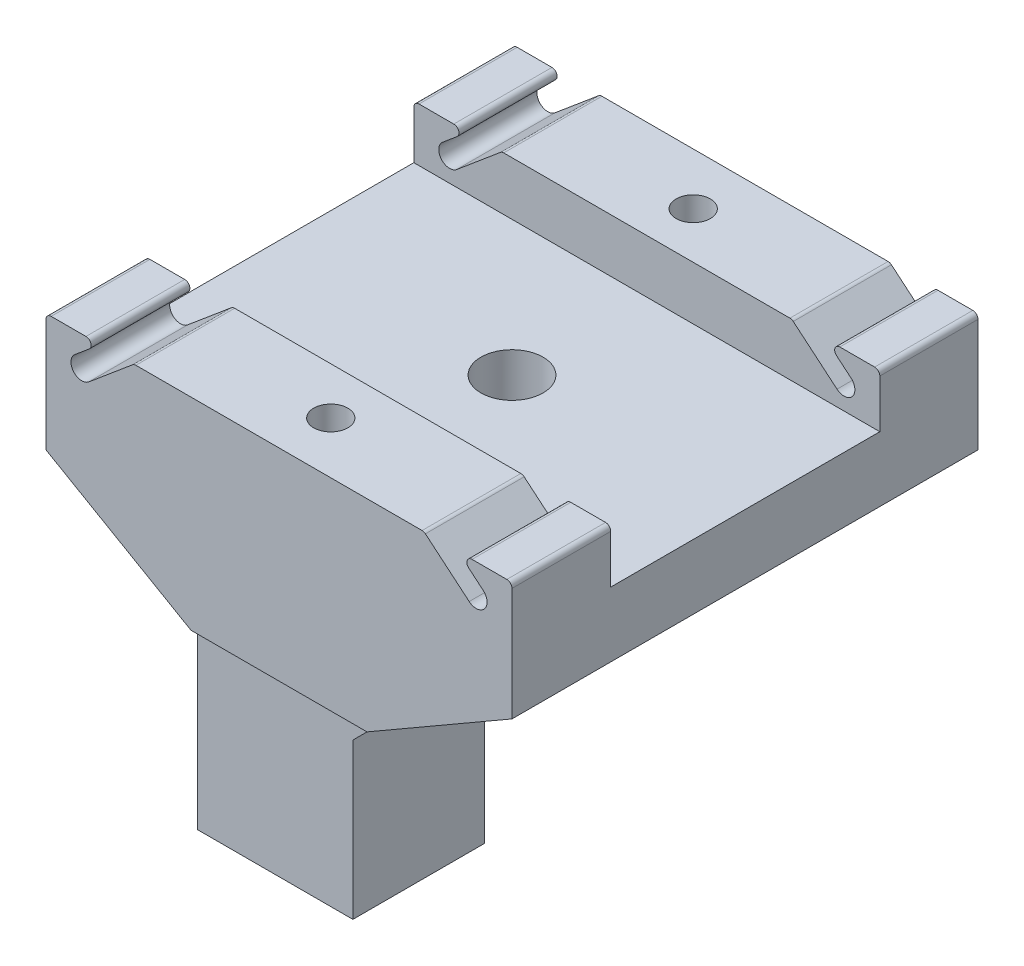
from build123d import *
from OCP.BRepFilletAPI import BRepFilletAPI_MakeChamfer

# Parameters (mm, degrees)
SKETCH1_W                 = 45
SKETCH1_H                 = 19.5
BOSS_EXTRUDE1_DEPTH       = 22.5
M4X0_7_TAPPED_HOLE2_D     = 3.3
BOSS_EXTRUDE3_DEPTH       = 6.3625
M4X0_7_TAPPED_HOLE1_D     = 3.3
M4X0_7_TAPPED_HOLE1_DEPTH = 10
M4X0_7_TAPPED_HOLE1_TIP   = 0.991420021
CUT_EXTRUDE2_DEPTH        = 85
SKETCH2_R                 = 3
CUT_EXTRUDE1_DEPTH        = 50
CUT_EXTRUDE3_DEPTH        = 25
FILLET1_R                 = 1.05
FILLET2_R                 = 1.05
FILLET3_R                 = 0.5
SKETCH12_W                = 25.984765903
SKETCH12_H                = 10.03603234
CUT_EXTRUDE4_DEPTH        = 72.15
CHAMFER1_SIZE             = 14
CHAMFER1_SIZE_2           = 8.082903769


with BuildPart() as part:
    # Sketch1 → Boss-Extrude1 (new, symmetric)
    with BuildSketch(Plane.XY):
        with Locations((0, -0.25)):
            Rectangle(SKETCH1_W, SKETCH1_H)
    extrude(amount=BOSS_EXTRUDE1_DEPTH, both=True)

    # M4x0.7 Tapped Hole2 (through all)
    with Locations(Plane(origin=(0, -10, 0), x_dir=(-1, 0, 0), z_dir=(0, -1, 0))):
        with Locations((0, -17.5), (0, 17.5)):
            Hole(M4X0_7_TAPPED_HOLE2_D / 2)

    # Sketch7 → Boss-Extrude3 (add, symmetric)
    with BuildSketch(Plane.XY):
        Polygon((-22.5, -7.5), (-24, -7.5), (-24, -42.5), (-9, -42.5), (-9, -27.5), (8.5, -10), (-22.5, -10), align=None)
    extrude(amount=BOSS_EXTRUDE3_DEPTH, both=True)

    # M4x0.7 Tapped Hole1
    with Locations(Plane(origin=(-24, 0, 0), x_dir=(0, 0, -1), z_dir=(-1, 0, 0))):
        with Locations((0, 37.5), (0, 22.5)):
            Hole(M4X0_7_TAPPED_HOLE1_D / 2, depth=M4X0_7_TAPPED_HOLE1_DEPTH)
            with Locations((0, 0, -(M4X0_7_TAPPED_HOLE1_DEPTH + M4X0_7_TAPPED_HOLE1_TIP / 2))):  # 118° drill point
                Cone(0, M4X0_7_TAPPED_HOLE1_D / 2, M4X0_7_TAPPED_HOLE1_TIP, mode=Mode.SUBTRACT)

    # Sketch10 → Cut-Extrude2 (cut)
    with BuildSketch(Plane(origin=(0, 0, -6.3625), x_dir=(-1, 0, 0), z_dir=(0, 0, -1))):
        Polygon((22.5, -10), (24, -11.5), (24, -7.5), (22.5, -7.5), align=None)
    extrude(amount=-CUT_EXTRUDE2_DEPTH, mode=Mode.SUBTRACT)

    # Sketch2 → Cut-Extrude1 (cut)
    with BuildSketch(Plane(origin=(0, 9.5, 0), x_dir=(1, 0, 0), z_dir=(0, 1, 0))):
        with Locations(Location((0, 0, 0), (0, 0, 180))):
            Circle(SKETCH2_R)
    extrude(amount=-CUT_EXTRUDE1_DEPTH, mode=Mode.SUBTRACT)

    # Sketch11 → Cut-Extrude3 (cut, symmetric)
    with BuildSketch(Plane.XY):
        Polygon((-17.267020036, 9.5), (-20.520653971, 6.769876965), (-19.170799991, 5.161183635), (-14, 9.5), align=None)
        Polygon((14, 9.5), (17.267020036, 9.5), (20.520653971, 6.769876965), (19.170799991, 5.161183635), align=None)
    extrude(amount=CUT_EXTRUDE3_DEPTH, both=True, mode=Mode.SUBTRACT)

    # Fillet1
    fillet1_edges = [part.edges().sort_by_distance(p)[0] for p in [
        (-19.170799991, 5.161183635, 0),
        (-20.520653971, 6.769876965, 0),
    ]]
    fillet(fillet1_edges, radius=FILLET1_R - 0.0001)  # a hair under: the kernel refuses the full size

    # Fillet2
    fillet2_edges = [part.edges().sort_by_distance(p)[0] for p in [
        (19.170799991, 5.161183635, 0),
        (20.520653971, 6.769876965, 0),
    ]]
    fillet(fillet2_edges, radius=FILLET2_R - 0.0001)  # a hair under: the kernel refuses the full size

    # Fillet3
    fillet3_edges = [part.edges().sort_by_distance(p)[0] for p in [
        (14, 9.5, 0),
        (17.267020036, 9.5, 0),
        (-22.5, 9.5, 0),
        (22.5, 9.5, 0),
        (-17.267020036, 9.5, 0),
        (-14, 9.5, 0),
    ]]
    fillet(fillet3_edges, radius=FILLET3_R)

    # Sketch12 → Cut-Extrude4 (cut)
    with BuildSketch(Plane(origin=(22.5, 0, 0), x_dir=(0, 0, -1), z_dir=(1, 0, 0))):
        with Locations((0.027906174, 9.360607609)):
            Rectangle(SKETCH12_W, SKETCH12_H)
    extrude(amount=-CUT_EXTRUDE4_DEPTH, mode=Mode.SUBTRACT)

    # Chamfer1
    chamfer1_edges_1 = [part.edges().sort_by_distance(p)[0] for p in [
        (-22.5, -10, -14.43125),
    ]]
    chamfer1_side_1 = [part.faces().sort_by_distance(p)[0] for p in [
        (-22.338341925, -10, -14.43125),
    ]]
    chamfer1_edges_2 = [part.edges().sort_by_distance(p)[0] for p in [
        (22.5, -10, 0),
    ]]
    chamfer1_side_2 = [part.faces().sort_by_distance(p)[0] for p in [
        (22.5, -9.838341925, 0),
    ]]
    chamfer1_edges_3 = [part.edges().sort_by_distance(p)[0] for p in [
        (-22.5, -10, 14.43125),
    ]]
    chamfer1_side_3 = [part.faces().sort_by_distance(p)[0] for p in [
        (-22.338341925, -10, 14.43125),
    ]]
    chamfer1 = BRepFilletAPI_MakeChamfer(part.part.solid().wrapped)
    for e in chamfer1_edges_1:
        chamfer1.Add(CHAMFER1_SIZE - 0.0001, CHAMFER1_SIZE_2 - 0.0001, e.wrapped, chamfer1_side_1[0].wrapped)
    for e in chamfer1_edges_2:
        chamfer1.Add(CHAMFER1_SIZE_2 - 0.0001, CHAMFER1_SIZE - 0.0001, e.wrapped, chamfer1_side_2[0].wrapped)
    for e in chamfer1_edges_3:
        chamfer1.Add(CHAMFER1_SIZE - 0.0001, CHAMFER1_SIZE_2 - 0.0001, e.wrapped, chamfer1_side_3[0].wrapped)
    add(Compound.cast(chamfer1.Shape()), mode=Mode.REPLACE)  # a hair under: the kernel refuses the full size


solid = part.part
